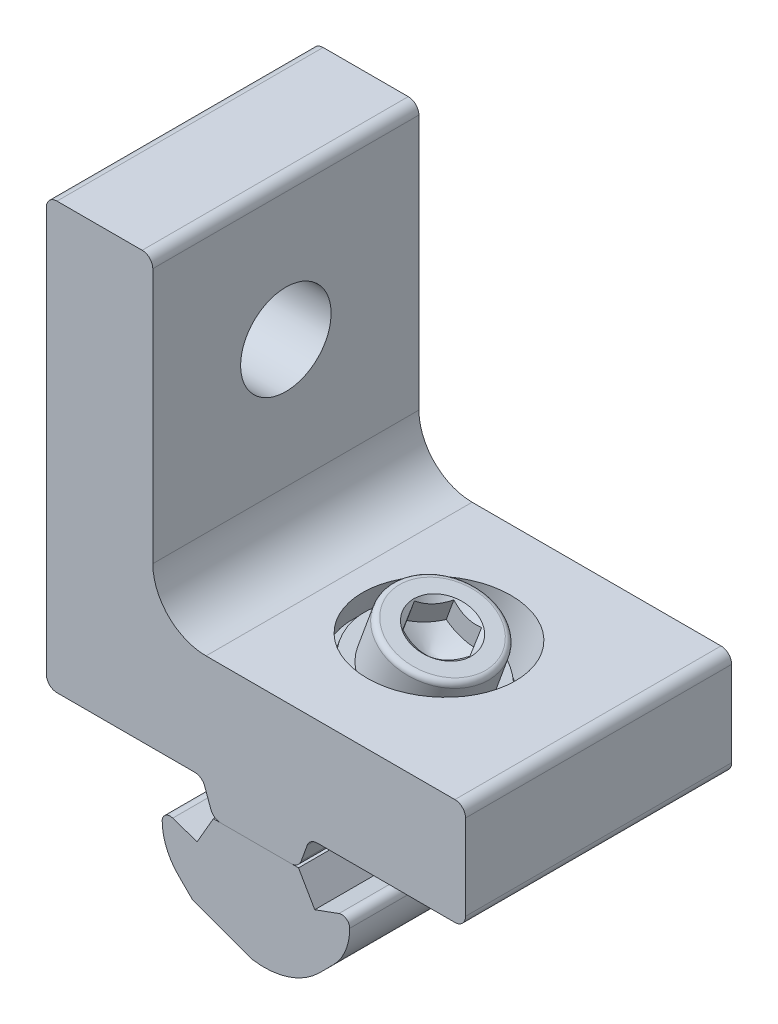
from build123d import *

# Parameters (mm, degrees)
BOSS_EXTRUDE1_DEPTH  = 12.5
BOSS_EXTRUDE2_DEPTH  = 25
FILLET1_R            = 1
SKETCH5_R            = 4.25
CUT_EXTRUDE1_DEPTH   = 52.180410315
CUT_EXTRUDE2_START   = -2.185640545
CUT_EXTRUDE2_DEPTH   = 3.185640545
CUT_EXTRUDE2_START_2 = 9.581895702
CUT_EXTRUDE2_2_DEPTH = 0.214359555
FILLET2_R            = 0.5


with BuildPart() as part:
    # Sketch3 → Boss-Extrude1 (new, symmetric)
    with BuildSketch(Plane.XY):
        with BuildLine():
            Line((-19.69, 0), (-19.69, 40))
            Line((-19.69, 40), (-9.69, 40))
            Line((-9.69, 40), (-9.69, 15))
            ThreePointArc((-9.69, 15), (-8.225533906, 11.464466094), (-4.69, 10))
            Line((-4.69, 10), (19.69, 10))
            Line((19.69, 10), (19.69, 0))
            Line((19.69, 0), (5.055513679, 0))
            Line((5.055513679, 0), (4, -2.9))
            Line((4, -2.9), (-4, -2.9))
            Line((-4, -2.9), (-5.055513679, 0))
            Line((-5.055513679, 0), (-19.69, 0))
        make_face()
    extrude(amount=BOSS_EXTRUDE1_DEPTH, both=True)

    # Fillet1
    fillet1_edges = [part.edges().sort_by_distance(p)[0] for p in [
        (-19.69, 0, 0),
        (-19.69, 40, 0),
        (-9.69, 40, 0),
        (19.69, 10, 0),
        (19.69, 0, 0),
        (5.055513679, 0, 0),
        (4, -2.9, 0),
        (-4, -2.9, 0),
        (-5.055513679, 0, 0),
    ]]
    fillet(fillet1_edges, radius=FILLET1_R)

    # Sketch5 → Cut-Extrude1 (cut, through all)
    with BuildSketch(Plane(origin=(-9.69, 0, 0), x_dir=(0, 0, -1), z_dir=(1, 0, 0))):
        with Locations(Location((0, 27, 0), (0, 0, 90))):
            Circle(SKETCH5_R)
    extrude(amount=-CUT_EXTRUDE1_DEPTH, mode=Mode.SUBTRACT)


with BuildPart() as body_2:
    # Sketch4 → Boss-Extrude2 (new body)
    with BuildSketch(Plane(origin=(0, 0, -12.5), x_dir=(-1, 0, 0), z_dir=(0, 0, -1))):
        with BuildLine():
            Line((5.951811032, -10.481053216), (7.257797729, -9.183813367))
            ThreePointArc((7.257797729, -9.183813367), (8.40157105, -7.484424253), (8.807951751, -5.476690332))
            ThreePointArc((8.807951751, -5.476690332), (8.495563879, -4.8650732), (7.816237548, -4.764189924))
            Line((7.816237548, -4.764189924), (5.524133229, -5.544554929))
            Line((5.524133229, -5.544554929), (4, -2.9))
            Line((4, -2.9), (-4, -2.9))
            Line((-4, -2.9), (-5.52615963, -5.54338602))
            Line((-5.52615963, -5.54338602), (-7.801440877, -4.715251372))
            ThreePointArc((-7.801440877, -4.715251372), (-8.487105577, -4.804934967), (-8.807951751, -5.41750085))
            ThreePointArc((-8.807951751, -5.41750085), (-8.415072056, -7.427920287), (-7.282744336, -9.134957107))
            Line((-7.282744336, -9.134957107), (-5.985504487, -10.440943804))
            ThreePointArc((-5.985504487, -10.440943804), (-3.08532669, -12.237943633), (0.313655308, -12.533174076))
            Line((0.313655308, -12.533174076), (5.951811032, -10.481053216))
        make_face()
    extrude(amount=-BOSS_EXTRUDE2_DEPTH)


with BuildPart() as cut_revolve1_tool:
    # Sketch7 → Cut-Revolve1 (revolve)
    with BuildSketch(Plane.XY):
        Polygon((-3.13273317, -11.507113646), (5.535490796, 12.308635967), (11.878415986, 10), (9.218290041, 2.691364033), (5.694442713, 3.97393957), (-0.313655308, -12.533174076), align=None)
    revolve(axis=Axis((-3.13273317, -11.507113646, 0), (0.3420201433256561, 0.939692620785913, 0)))


with BuildPart() as part_1:
    add(part.part)

    # Cut-Revolve1: cut by cut_revolve1_tool
    add(cut_revolve1_tool.part, mode=Mode.SUBTRACT)


with BuildPart() as body_2_1:
    add(body_2.part)

    # Cut-Revolve1: cut by cut_revolve1_tool
    add(cut_revolve1_tool.part, mode=Mode.SUBTRACT)


with BuildPart() as body_3:
    # Sketch8 → Revolve1 (revolve)
    with BuildSketch(Plane.XY):
        Polygon((-1.025728279, -12.27400071), (-3.13273317, -11.507113646), (3.735326397, 7.362724931), (6.4645057, 7.843952877), (7.285354044, 10.099215167), (9.540616333, 9.278366823), (7.898919645, 4.767842243), (6.207472928, 5.383478501), (-0.054481942, -11.821101105), align=None)
    revolve(axis=Axis((-3.13273317, -11.507113646, 0), (0.34202014332565683, 0.9396926207859128, 0)))

    # Cut-Extrude2: read off the stored shape, not the designer's step
    # Cut-Extrude2 outline → Cut-Extrude2 (cut)
    with BuildSketch(Plane(origin=(4.09804972, 11.259299068, 0), x_dir=(0.9396926207859128, -0.34202014332565694, 0), z_dir=(0.3420201433256569, 0.9396926207859126, 0)).offset(CUT_EXTRUDE2_START)):
        with BuildLine():
            Line((-1.086593285, 1.200016053), (-1.779422876, 0))
            Line((-1.779422876, 0), (-1.086593285, -1.200016053))
            ThreePointArc((-1.086593285, -1.200016053), (-1.408141584, 0), (-1.086593285, 1.200016053))
        make_face()
        with BuildLine():
            ThreePointArc((0.991858416, -2.4), (-0.208133558, -2.078465603), (-1.086593285, -1.200016053))
            Line((-1.086593285, -1.200016053), (-0.39378223, -2.4))
            Line((-0.39378223, -2.4), (0.991858416, -2.4))
        make_face()
        with BuildLine():
            Line((-0.39378223, 2.4), (-1.086593285, 1.200016053))
            ThreePointArc((-1.086593285, 1.200016053), (-0.208133558, 2.078465603), (0.991858416, 2.4))
            Line((0.991858416, 2.4), (-0.39378223, 2.4))
        make_face()
        with BuildLine():
            ThreePointArc((3.070310117, -1.200016053), (2.19185039, -2.078465603), (0.991858416, -2.4))
            Line((0.991858416, -2.4), (2.377499062, -2.4))
            Line((2.377499062, -2.4), (3.070310117, -1.200016053))
        make_face()
        with BuildLine():
            Line((2.377499062, 2.4), (0.991858416, 2.4))
            ThreePointArc((0.991858416, 2.4), (2.19185039, 2.078465603), (3.070310117, 1.200016053))
            Line((3.070310117, 1.200016053), (2.377499062, 2.4))
        make_face()
        with BuildLine():
            ThreePointArc((3.070310117, 1.200016053), (3.391858416, 0), (3.070310117, -1.200016053))
            Line((3.070310117, -1.200016053), (3.763139708, 0))
            Line((3.763139708, 0), (3.070310117, 1.200016053))
        make_face()
    extrude(amount=CUT_EXTRUDE2_DEPTH, mode=Mode.SUBTRACT)

    # Cut-Extrude2 2 outline → Cut-Extrude2 2 (cut)
    with BuildSketch(Plane(origin=(0, 0, 0), x_dir=(0.9396926207859128, -0.34202014332565644, 0), z_dir=(0.34202014332565644, 0.9396926207859129, 0)).offset(CUT_EXTRUDE2_START_2)):
        with BuildLine():
            Line((-1.086593285, 1.200016053), (-1.779422876, 0))
            Line((-1.779422876, 0), (-1.086593285, -1.200016053))
            ThreePointArc((-1.086593285, -1.200016053), (-1.408141584, 0), (-1.086593285, 1.200016053))
        make_face()
        with BuildLine():
            ThreePointArc((0.991858416, -2.4), (-0.208133558, -2.078465603), (-1.086593285, -1.200016053))
            Line((-1.086593285, -1.200016053), (-0.39378223, -2.4))
            Line((-0.39378223, -2.4), (0.991858416, -2.4))
        make_face()
        with BuildLine():
            Line((-0.39378223, 2.4), (-1.086593285, 1.200016053))
            ThreePointArc((-1.086593285, 1.200016053), (-0.208133558, 2.078465603), (0.991858416, 2.4))
            Line((0.991858416, 2.4), (-0.39378223, 2.4))
        make_face()
        with BuildLine():
            ThreePointArc((3.070310117, -1.200016053), (2.19185039, -2.078465603), (0.991858416, -2.4))
            Line((0.991858416, -2.4), (2.377499062, -2.4))
            Line((2.377499062, -2.4), (3.070310117, -1.200016053))
        make_face()
        with BuildLine():
            Line((2.377499062, 2.4), (0.991858416, 2.4))
            ThreePointArc((0.991858416, 2.4), (2.19185039, 2.078465603), (3.070310117, 1.200016053))
            Line((3.070310117, 1.200016053), (2.377499062, 2.4))
        make_face()
        with BuildLine():
            ThreePointArc((3.070310117, 1.200016053), (3.391858416, 0), (3.070310117, -1.200016053))
            Line((3.070310117, -1.200016053), (3.763139708, 0))
            Line((3.763139708, 0), (3.070310117, 1.200016053))
        make_face()
    extrude(amount=CUT_EXTRUDE2_2_DEPTH, mode=Mode.SUBTRACT)

    # Cut-Extrude2 3 outline → Cut-Extrude2 3 (revolve)
    with BuildSketch(Plane(origin=(0.932042034, -0.339235557, 0), x_dir=(0.9396926207859126, -0.342020143325657, 0), z_dir=(0, 0, 1))):
        Polygon((2.771281293, 9.796255156), (2.399999957, 9.581895777), (2.771281292, 9.581895702), align=None)
    revolve(axis=Axis((0.932042034, -0.339235557, 0), (0.342020143325657, 0.9396926207859126, 0)))

    # Cut-Extrude3 cone 1 section (through the dimple's axis) → Cut-Extrude3 (revolve, cut)
    with BuildSketch(Plane(origin=(5.030091754, 10.920063511, 0), x_dir=(0, 0, 1), z_dir=(0.939692621, -0.342020143, 0))):
        Polygon((0, 0), (2.88, 0), (0, 2.88), align=None)
    revolve(axis=Axis((5.030091754, 10.920063511, 0), (-0.342020143, -0.939692621, 0)), mode=Mode.SUBTRACT)

    # Fillet2
    fillet2_edges = [body_3.edges().sort_by_distance(p)[0] for p in [
        (0.519567174, 12.561760199, 0),
    ]]
    fillet(fillet2_edges, radius=FILLET2_R)


with BuildPart() as body_4:
    # Sketch8<3> → Revolve2 (revolve)
    with BuildSketch(Plane.XY):
        Polygon((6.207472928, 5.383478501), (5.694442713, 3.97393957), (8.583997522, 2.922227629), (9.097027737, 4.33176656), (7.898919645, 4.767842243), align=None)
    revolve(axis=Axis((-3.13273317, -11.507113646, 0), (0.34202014332565683, 0.9396926207859128, 0)))


solid = Compound([part_1.part, body_2_1.part, body_3.part, body_4.part])
